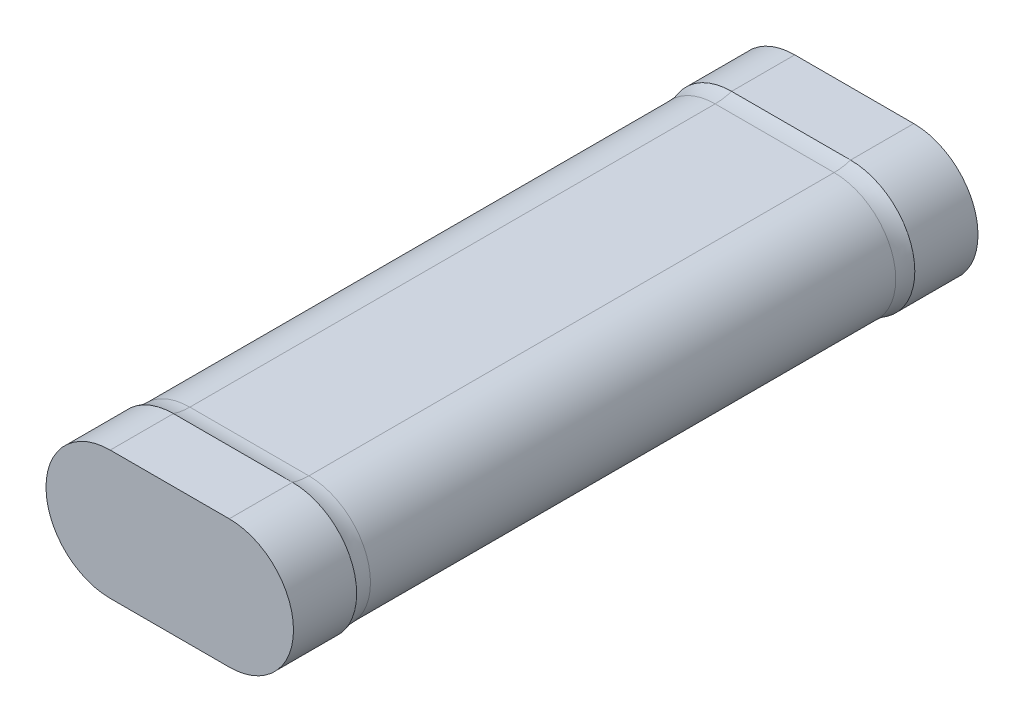
from build123d import *

# Parameters (mm, degrees)
BOSS_EXTRUDE1_DEPTH      = 65
BOSS_EXTRUDE1_DEPTH_BACK = 65
BOSS_EXTRUDE2_DEPTH      = 12
FILLET1_R                = 10
FILLET2_R                = 10


with BuildPart() as part:
    # Sketch1 → Boss-Extrude1 (new, two sides: drawn at the far end of the back side and taken through both)
    with BuildSketch(Plane.XY.offset(-BOSS_EXTRUDE1_DEPTH_BACK)):
        with BuildLine():
            Line((-11.3, 11.7), (11.3, 11.7))
            ThreePointArc((11.3, 11.7), (23, 0), (11.3, -11.7))
            Line((11.3, -11.7), (-11.3, -11.7))
            ThreePointArc((-11.3, -11.7), (-23, 0), (-11.3, 11.7))
        make_face()
    extrude(amount=BOSS_EXTRUDE1_DEPTH + BOSS_EXTRUDE1_DEPTH_BACK)

    # Sketch2 → Boss-Extrude2 (add)
    with BuildSketch(Plane.XY.offset(65)):
        with BuildLine():
            Line((-11.3, 12.2), (11.3, 12.2))
            ThreePointArc((11.3, 12.2), (23.5, 0), (11.3, -12.2))
            Line((11.3, -12.2), (-11.3, -12.2))
            ThreePointArc((-11.3, -12.2), (-23.5, 0), (-11.3, 12.2))
        make_face()
    boss_extrude2 = extrude(amount=-BOSS_EXTRUDE2_DEPTH)

    # Mirror1: Boss-Extrude2 across plane
    add(boss_extrude2.mirror(Plane.XY))

    # Fillet1
    # the kernel refuses this fillet: 10 mm, written as the material it adds along each edge
    with BuildSketch(Plane(origin=(-11.3, -11.7, 53), x_dir=(0, -1.0, -2.188471626126437e-12), z_dir=(1, 0, 0)), Plane(origin=(11.3, 11.7, 53), x_dir=(0, 1.0, -2.188471626126375e-12), z_dir=(-1, 0, 0))) as fillet1_piece_1:
        with BuildLine():
            CenterArc((10, 3.122498999), FILLET1_R, 180, 18.194872339)
            Line((0, 3.122498999), (-0.2, 3.122498999))
            Line((-0.2, 3.122498999), (-0.2, 0))
            Line((-0.2, 0), (0, -0.2))
            ThreePointArc((0, -0.2), (0.25, -0.2), (0.31, -0.06244998))
            Line((0.31, -0.06244998), (0.5, 0))
        make_face()
    extrude(amount=22.6)
    with BuildSketch(Plane(origin=(-11.3, 0, 53), x_dir=(0, -1, 0), z_dir=(1, 0, 0))) as fillet1_piece_2:
        with BuildLine():
            CenterArc((21.7, 3.122498999), FILLET1_R, 180, 18.194872339)
            Line((11.7, 3.122498999), (11.5, 3.122498999))
            Line((11.5, 3.122498999), (11.5, 0))
            Line((11.5, 0), (11.7, -0.2))
            ThreePointArc((11.7, -0.2), (11.95, -0.2), (12.01, -0.06244998))
            Line((12.01, -0.06244998), (12.2, 0))
        make_face()
    revolve(axis=Axis((-11.3, 0, 53), (0, 0, -1)), revolution_arc=180)
    with BuildSketch(Plane(origin=(11.3, 0, 53), x_dir=(0, 1, 0), z_dir=(-1, 0, 0))) as fillet1_piece_3:
        with BuildLine():
            CenterArc((21.7, 3.122498999), FILLET1_R, 180, 18.194872339)
            Line((11.7, 3.122498999), (11.5, 3.122498999))
            Line((11.5, 3.122498999), (11.5, 0))
            Line((11.5, 0), (11.7, -0.2))
            ThreePointArc((11.7, -0.2), (11.95, -0.2), (12.01, -0.06244998))
            Line((12.01, -0.06244998), (12.2, 0))
        make_face()
    revolve(axis=Axis((11.3, 0, 53), (0, 0, -1)), revolution_arc=180)

    # Fillet2
    # the kernel refuses this fillet: 10 mm, written as the material it adds along each edge
    with BuildSketch(Plane(origin=(-11.3, -11.7, -53), x_dir=(0, -1.0, 2.188471626126437e-12), z_dir=(1, 0, 0))) as fillet2_piece_1:
        with BuildLine():
            CenterArc((10, -3.122498999), FILLET2_R, 161.805127661, 18.194872339)
            Line((0, -3.122498999), (-0.2, -3.122498999))
            Line((-0.2, -3.122498999), (-0.2, 0))
            Line((-0.2, 0), (0, 0.2))
            ThreePointArc((0, 0.2), (0.25, 0.2), (0.31, 0.06244998))
            Line((0.31, 0.06244998), (0.5, 0))
        make_face()
    extrude(amount=22.6)
    with BuildSketch(Plane(origin=(11.3, 11.7, -53), x_dir=(0, 0, 1), z_dir=(-1, 0, 0))) as fillet2_piece_2:
        with BuildLine():
            CenterArc((3.122498999, 10), FILLET2_R, 251.805127661, 18.194872339)
            Line((0, 0.5), (-0.06244998, 0.31))
            ThreePointArc((-0.06244998, 0.31), (-0.2, 0.25), (-0.2, 0))
            Line((-0.2, 0), (0, -0.2))
            Line((0, -0.2), (3.122498999, -0.2))
            Line((3.122498999, -0.2), (3.122498999, 0))
        make_face()
    extrude(amount=22.6)
    with BuildSketch(Plane(origin=(-11.3, 0, -53), x_dir=(0, -1, 0), z_dir=(1, 0, 0))) as fillet2_piece_3:
        with BuildLine():
            CenterArc((21.7, -3.122498999), FILLET2_R, 161.805127661, 18.194872339)
            Line((11.7, -3.122498999), (11.5, -3.122498999))
            Line((11.5, -3.122498999), (11.5, 0))
            Line((11.5, 0), (11.7, 0.2))
            ThreePointArc((11.7, 0.2), (11.95, 0.2), (12.01, 0.06244998))
            Line((12.01, 0.06244998), (12.2, 0))
        make_face()
    revolve(axis=Axis((-11.3, 0, -53), (0, 0, -1)), revolution_arc=180)
    with BuildSketch(Plane(origin=(11.3, 0, -53), x_dir=(0, 1, 0), z_dir=(-1, 0, 0))) as fillet2_piece_4:
        with BuildLine():
            CenterArc((21.7, -3.122498999), FILLET2_R, 161.805127661, 18.194872339)
            Line((12.2, 0), (12.01, 0.06244998))
            ThreePointArc((12.01, 0.06244998), (11.95, 0.2), (11.7, 0.2))
            Line((11.7, 0.2), (11.5, 0))
            Line((11.5, 0), (11.5, -3.122498999))
            Line((11.5, -3.122498999), (11.7, -3.122498999))
        make_face()
    revolve(axis=Axis((11.3, 0, -53), (0, 0, -1)), revolution_arc=180)


solid = part.part
